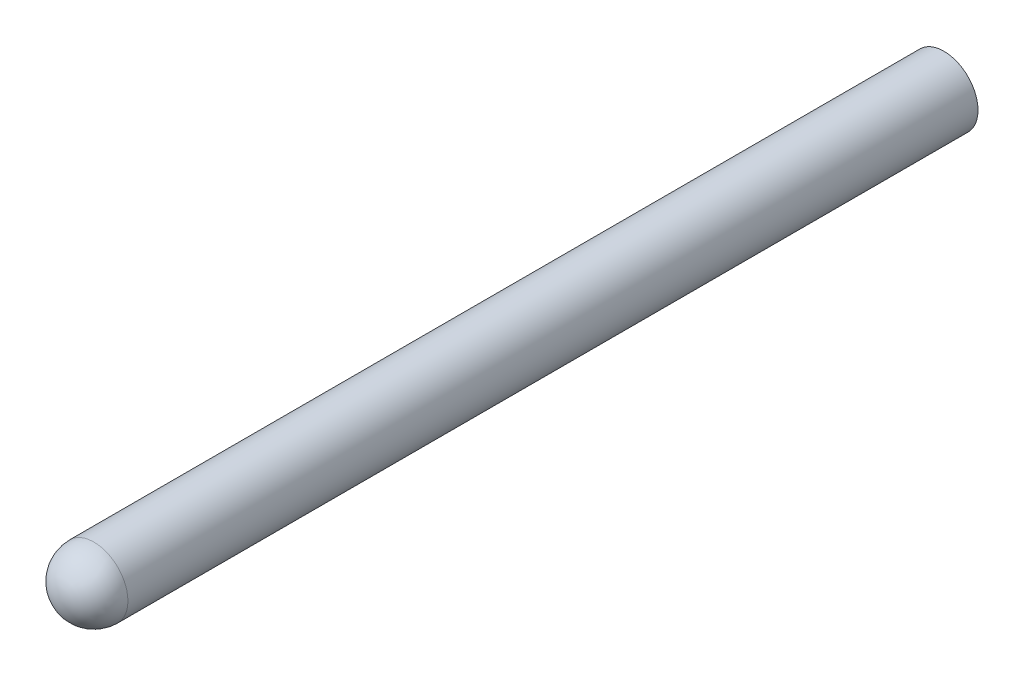
from build123d import *

# Parameters (mm, degrees)
SKETCH1_R           = 4
BOSS_EXTRUDE1_DEPTH = 100


with BuildPart() as part:
    # Sketch1 → Boss-Extrude1 (new body)
    with BuildSketch(Plane.XY):
        Circle(SKETCH1_R)
    extrude(amount=BOSS_EXTRUDE1_DEPTH)

    # Sketch2 → Revolve2 (revolve)
    with BuildSketch(Plane(origin=(0, 0, 0), x_dir=(1, 0, 0), z_dir=(0, 1, 0))):
        with BuildLine():
            Line((4, -100), (0, -100))
            Line((0, -100), (0, -104))
            ThreePointArc((0, -104), (2.828427125, -102.828427125), (4, -100))
        make_face()
    revolve(axis=Axis((0, 0, 100), (0, 0, 1)))


solid = part.part
